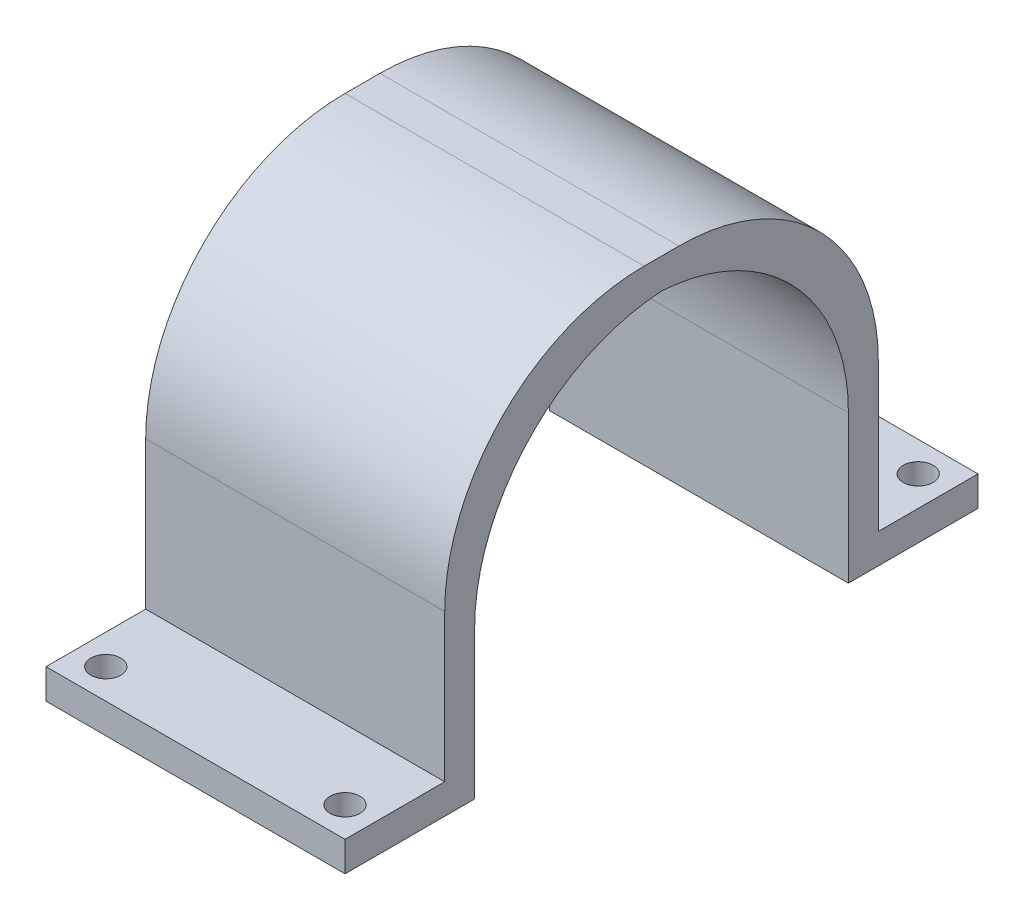
from build123d import *

# Parameters (mm, degrees)
BOSS_EXTRUDE2_DEPTH = 30
FILLET1_R           = 20
SKETCH7_R           = 1.5
CUT_EXTRUDE2_DEPTH  = 79.379142634


with BuildPart() as part:
    # Sketch6 → Boss-Extrude2 (new body)
    with BuildSketch(Plane(origin=(0, 0, 0), x_dir=(0, 0, -1), z_dir=(1, 0, 0))):
        Polygon((0, 0), (10, 0), (10, 34.8), (53.5, 34.8), (53.5, 0), (63.5, 0), (63.5, -3), (50.5, -3), (50.5, 31.8), (13, 31.8), (13, -3), (0, -3), align=None)
    extrude(amount=BOSS_EXTRUDE2_DEPTH)

    # Fillet1
    # the kernel refuses this fillet: 20 mm, written as the material it adds along each edge
    with BuildSketch(Plane(origin=(0, 31.8, -13), x_dir=(0, 0, -1), z_dir=(1, 0, 0)), Plane(origin=(0, 31.8, -50.5), x_dir=(0, -1, 0), z_dir=(1, 0, 0))) as fillet1_piece_1:
        with BuildLine():
            CenterArc((FILLET1_R, -FILLET1_R), FILLET1_R, 90, 90)
            Line((0, -FILLET1_R), (0, 0))
            Line((0, 0), (FILLET1_R, 0))
        make_face()
    extrude(amount=30)
    # the kernel refuses this fillet: 20 mm, written as the material it takes off along each edge
    with BuildSketch(Plane(origin=(-50, 34.8, -10), x_dir=(0, -1, 0), z_dir=(1, 0, 0)), Plane(origin=(-50, 34.8, -53.5), x_dir=(0, 0, 1), z_dir=(1, 0, 0))) as fillet1_2_piece_1:
        with BuildLine():
            CenterArc((FILLET1_R, FILLET1_R), FILLET1_R, 180, 90)
            Line((0, FILLET1_R), (0, 0))
            Line((0, 0), (FILLET1_R, 0))
        make_face()
    extrude(amount=130, mode=Mode.SUBTRACT)

    # Sketch7 → Cut-Extrude2 (cut, through all)
    with BuildSketch(Plane(origin=(0, 0, 0), x_dir=(1, 0, 0), z_dir=(0, 1, 0))):
        with Locations(Location((27, 60.5, 0), (0, 0, 270))):
            Circle(SKETCH7_R)
        with Locations(Location((3, 60.5, 0), (0, 0, 270))):
            Circle(SKETCH7_R)
        with Locations(Location((3, 3, 0), (0, 0, 270))):
            Circle(SKETCH7_R)
        with Locations(Location((27, 3, 0), (0, 0, 270))):
            Circle(SKETCH7_R)
    extrude(amount=-CUT_EXTRUDE2_DEPTH, mode=Mode.SUBTRACT)


solid = part.part
